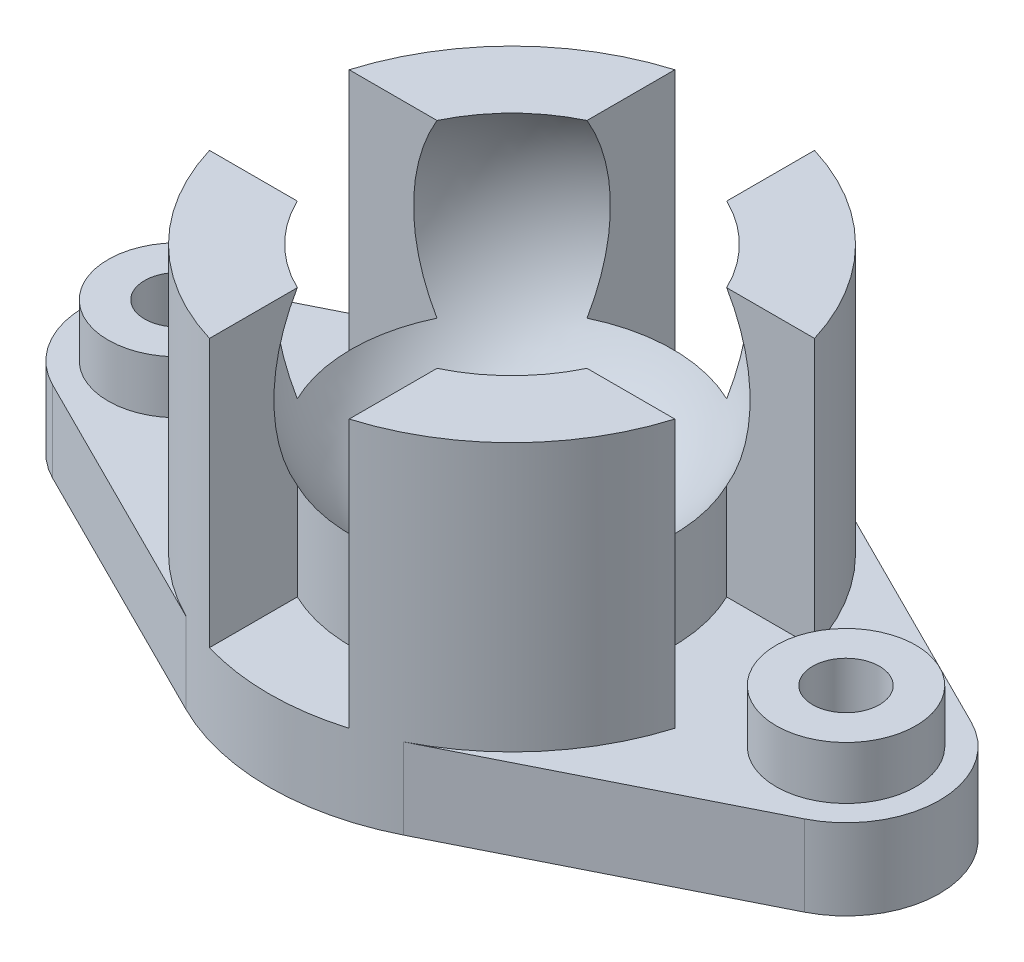
from build123d import *

# Parameters (mm, degrees)
BOSS_EXTRU_1_DEPTH      = 2.66
ESQUISSE1_3_R           = 2.3
BOSS_EXTRU_2_DEPTH      = 4.4
BOSS_EXTRU_3_DEPTH      = 11.48
ENL_V_START             = -8.82
ENL_V_MAT_EXTRU_1_DEPTH = 8.82
D_GAGEMENT_M22_D        = 2.2


with BuildPart() as part:
    # Esquisse1 → Boss.-Extru.1 (new body)
    with BuildSketch(Plane(origin=(0, 0, 0), x_dir=(1, 0, 0), z_dir=(0, 1, 0))):
        with BuildLine():
            Line((-3.58029257, 7.154125042), (-12.377113761, 2.751742729))
            ThreePointArc((-12.377113761, 2.751742729), (-14.077097717, 0), (-12.377113761, -2.751742729))
            Line((-12.377113761, -2.751742729), (-3.58029257, -7.154125042))
            ThreePointArc((-3.58029257, -7.154125042), (0, -8), (3.58029257, -7.154125042))
            Line((3.58029257, -7.154125042), (12.377113761, -2.751742729))
            ThreePointArc((12.377113761, -2.751742729), (14.077097717, 0), (12.377113761, 2.751742729))
            Line((12.377113761, 2.751742729), (3.58029257, 7.154125042))
            ThreePointArc((3.58029257, 7.154125042), (0, 8), (-3.58029257, 7.154125042))
        make_face()
    extrude(amount=BOSS_EXTRU_1_DEPTH)

    # Esquisse1<3> → Boss.-Extru.2 (add)
    with BuildSketch(Plane(origin=(0, 0, 0), x_dir=(1, 0, 0), z_dir=(0, 1, 0))):
        with Locations((-11, 0)):
            Circle(ESQUISSE1_3_R)
        with Locations((11, 0)):
            Circle(ESQUISSE1_3_R)
    extrude(amount=BOSS_EXTRU_2_DEPTH)

    # Esquisse1<4> → Boss.-Extru.3 (add)
    with BuildSketch(Plane(origin=(0, 0, 0), x_dir=(1, 0, 0), z_dir=(0, 1, 0))):
        with BuildLine():
            ThreePointArc((3.58029257, 7.154125042), (0, 8), (-3.58029257, 7.154125042))
            ThreePointArc((-3.58029257, 7.154125042), (-8, 0), (-3.58029257, -7.154125042))
            ThreePointArc((-3.58029257, -7.154125042), (0, -8), (3.58029257, -7.154125042))
            ThreePointArc((3.58029257, -7.154125042), (6.805965786, -4.204620045), (8, 0))
            ThreePointArc((8, 0), (6.805965786, 4.204620045), (3.58029257, 7.154125042))
        make_face()
    extrude(amount=BOSS_EXTRU_3_DEPTH)

    # Esquisse2 → Enlèvement de matière-Révolution7 (revolve, cut)
    with BuildSketch(Plane.XY):
        with BuildLine():
            ThreePointArc((0, 14.66), (-6, 8.66), (0, 2.66))
            Line((0, 2.66), (0, 14.66))
        make_face()
    revolve(axis=Axis((0, -0.733, 0), (0, 1, 0)), mode=Mode.SUBTRACT)

    # Esquisse3 → Enlèv. mat.-Extru.1 (cut)
    with BuildSketch(Plane(origin=(0, 11.48, 0), x_dir=(1, 0, 0), z_dir=(0, 1, 0)).offset(ENL_V_START)):
        with BuildLine():
            Line((-4.770492637, 2.3), (-7.662245102, 2.3))
            ThreePointArc((-7.662245102, 2.3), (-8, 0), (-7.662245102, -2.3))
            Line((-7.662245102, -2.3), (-4.770492637, -2.3))
            ThreePointArc((-4.770492637, -2.3), (-5.295998489, 0), (-4.770492637, 2.3))
        make_face()
        with BuildLine():
            ThreePointArc((2.3, 7.662245102), (0, 8), (-2.3, 7.662245102))
            Line((-2.3, 7.662245102), (-2.3, 4.770492637))
            ThreePointArc((-2.3, 4.770492637), (0, 5.295998489), (2.3, 4.770492637))
            Line((2.3, 4.770492637), (2.3, 7.662245102))
        make_face()
        with BuildLine():
            Line((-2.3, -4.770492637), (-2.3, -7.662245102))
            ThreePointArc((-2.3, -7.662245102), (0, -8), (2.3, -7.662245102))
            Line((2.3, -7.662245102), (2.3, -4.770492637))
            ThreePointArc((2.3, -4.770492637), (0, -5.295998489), (-2.3, -4.770492637))
        make_face()
        with BuildLine():
            ThreePointArc((7.662245102, -2.3), (8, 0), (7.662245102, 2.3))
            Line((7.662245102, 2.3), (4.770492637, 2.3))
            ThreePointArc((4.770492637, 2.3), (5.295998489, 0), (4.770492637, -2.3))
            Line((4.770492637, -2.3), (7.662245102, -2.3))
        make_face()
    extrude(amount=ENL_V_MAT_EXTRU_1_DEPTH, mode=Mode.SUBTRACT)

    # Dégagement M22 (through all)
    with Locations(Plane(origin=(11, 4.4, 0), x_dir=(0, 0, 1), z_dir=(0, 1, 0))):
        with Locations((0, 0), (0, -22)):
            Hole(D_GAGEMENT_M22_D / 2)


solid = part.part
